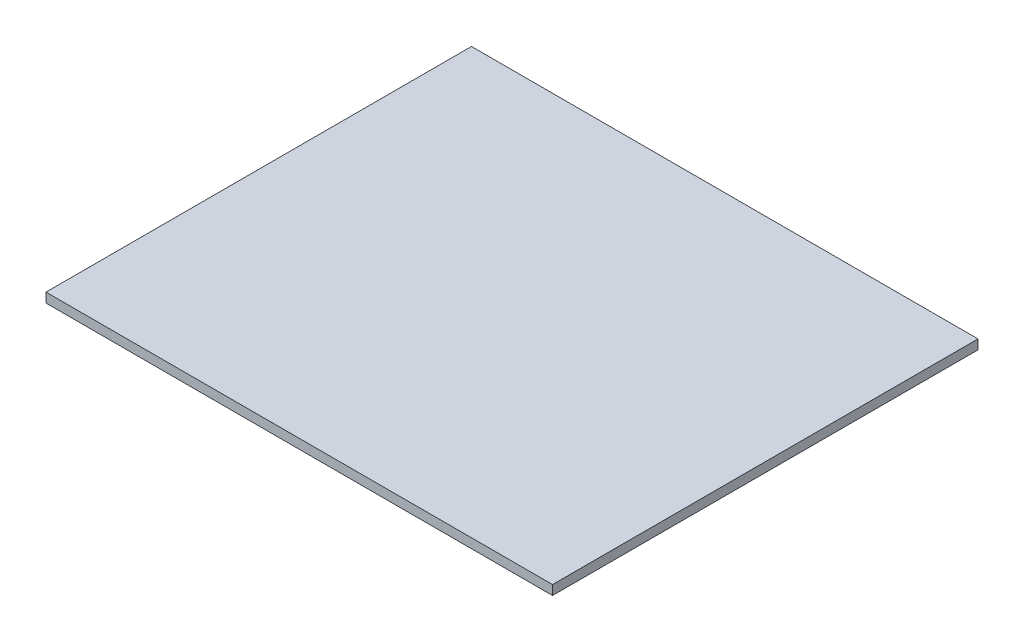
from build123d import *

# Parameters (mm, degrees)
SKETCH1_W           = 635
SKETCH1_H           = 533.4
BOSS_EXTRUDE1_DEPTH = 11.90625


with BuildPart() as part:
    # Sketch1 → Boss-Extrude1 (new body)
    with BuildSketch(Plane(origin=(0, 0, 0), x_dir=(1, 0, 0), z_dir=(0, 1, 0))):
        Rectangle(SKETCH1_W, SKETCH1_H)
    extrude(amount=BOSS_EXTRUDE1_DEPTH)


solid = part.part
